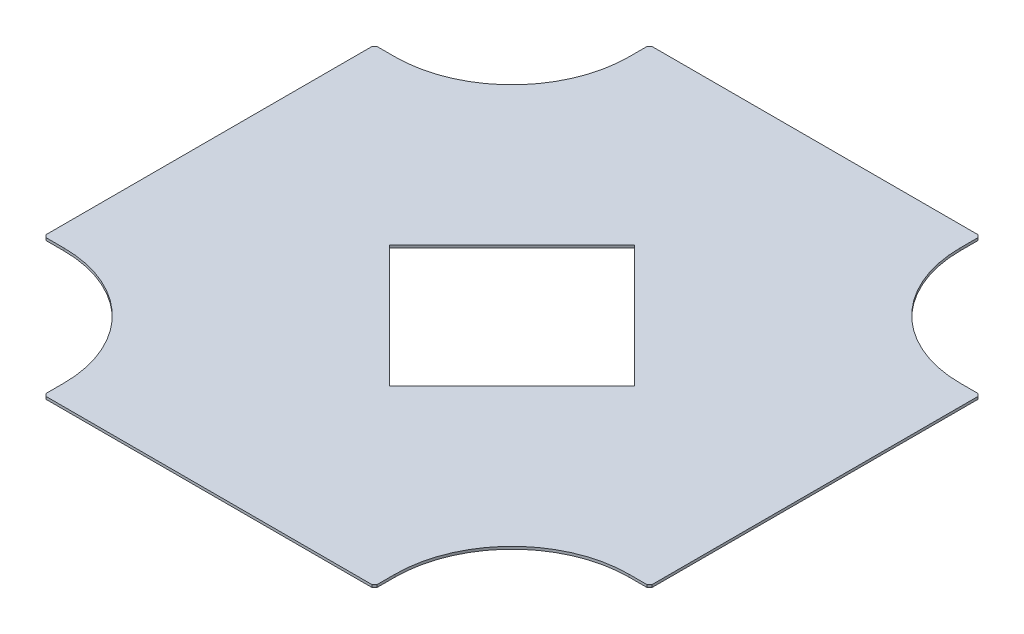
from build123d import *

# Parameters (mm, degrees)
SKETCH2_W           = 755.65
SKETCH2_H           = 755.65
BASE_FLANGE1_DEPTH  = 3.175
CUT_EXTRUDE1_DEPTH  = 535.334672162
CUT_EXTRUDE2_DEPTH  = 535.334672162
BREAK_CORNER1_START = -3.175
BREAK_CORNER1_DEPTH = 3.175


# Read off the part's stored shape, not the designer's step: Break-Corner1
# Sheet-metal steps are written as plain solids
with BuildPart() as part:
    # Sketch2 → Base-Flange1 (new body)
    with BuildSketch(Plane(origin=(0, 0, 0), x_dir=(1, 0, 0), z_dir=(0, 1, 0))):
        Rectangle(SKETCH2_W, SKETCH2_H)
    extrude(amount=-BASE_FLANGE1_DEPTH)

    # Sketch3 → Cut-Extrude1 (cut, through all)
    with BuildSketch(Plane(origin=(0, 0, 0), x_dir=(1, 0, 0), z_dir=(0, 1, 0))):
        Polygon((0, -152.664354058), (152.664354058, 0), (0, 152.664354058), (-152.664354058, 0), align=None)
    extrude(amount=-CUT_EXTRUDE1_DEPTH, mode=Mode.SUBTRACT)

    # Sketch4 → Cut-Extrude2 (cut, through all)
    with BuildSketch(Plane(origin=(0, 0, 0), x_dir=(1, 0, 0), z_dir=(0, 1, 0))):
        with BuildLine():
            Line((377.825, 206.375), (352.425, 206.375))
            ThreePointArc((352.425, 206.375), (249.152054608, 249.152054608), (206.375, 352.425))
            Line((206.375, 352.425), (206.375, 377.825))
            Line((206.375, 377.825), (377.825, 377.825))
            Line((377.825, 377.825), (377.825, 206.375))
        make_face()
        with BuildLine():
            Line((206.375, -377.825), (206.375, -352.425))
            ThreePointArc((206.375, -352.425), (249.152054608, -249.152054608), (352.425, -206.375))
            Line((352.425, -206.375), (377.825, -206.375))
            Line((377.825, -206.375), (377.825, -377.825))
            Line((377.825, -377.825), (206.375, -377.825))
        make_face()
        with BuildLine():
            Line((-377.825, -206.375), (-352.425, -206.375))
            ThreePointArc((-352.425, -206.375), (-249.152054608, -249.152054608), (-206.375, -352.425))
            Line((-206.375, -352.425), (-206.375, -377.825))
            Line((-206.375, -377.825), (-377.825, -377.825))
            Line((-377.825, -377.825), (-377.825, -206.375))
        make_face()
        with BuildLine():
            Line((-206.375, 377.825), (-206.375, 352.425))
            ThreePointArc((-206.375, 352.425), (-249.152054608, 249.152054608), (-352.425, 206.375))
            Line((-352.425, 206.375), (-377.825, 206.375))
            Line((-377.825, 206.375), (-377.825, 377.825))
            Line((-377.825, 377.825), (-206.375, 377.825))
        make_face()
    extrude(amount=-CUT_EXTRUDE2_DEPTH, mode=Mode.SUBTRACT)

    # Break-Corner1 outline → Break-Corner1 (cut)
    with BuildSketch(Plane(origin=(0, 0, 0), x_dir=(1, 0, 0), z_dir=(0, 1, 0)).offset(BREAK_CORNER1_START)):
        Polygon((-206.375, 374.65), (-203.2, 377.825), (-206.375, 377.825), align=None)
        Polygon((203.2, 377.825), (206.375, 374.65), (206.375, 377.825), align=None)
        Polygon((377.825, -206.375), (377.825, -203.2), (374.65, -206.375), align=None)
        Polygon((374.65, 206.375), (377.825, 203.2), (377.825, 206.375), align=None)
        Polygon((-374.65, -206.375), (-377.825, -203.2), (-377.825, -206.375), align=None)
        Polygon((-377.825, 203.2), (-374.65, 206.375), (-377.825, 206.375), align=None)
        Polygon((206.375, -374.65), (203.2, -377.825), (206.375, -377.825), align=None)
        Polygon((-203.2, -377.825), (-206.375, -374.65), (-206.375, -377.825), align=None)
    extrude(amount=BREAK_CORNER1_DEPTH, mode=Mode.SUBTRACT)


solid = part.part
